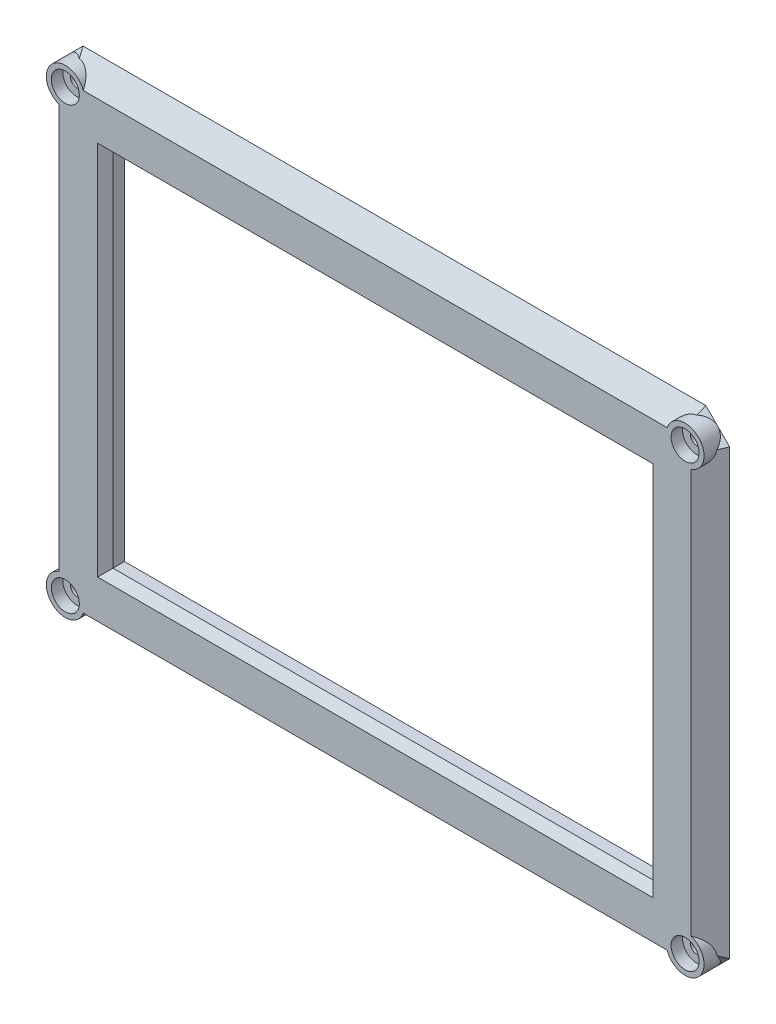
from build123d import *

# Parameters (mm, degrees)
SKETCH1_W                                  = 140.5
SKETCH1_H                                  = 93.8
BOSS_EXTRUDE1_DEPTH                        = 5
CHAMFER1_SIZE                              = 5
CHAMFER2_SIZE                              = 2
SKETCH2_R                                  = 1.65
CUT_EXTRUDE1_DEPTH                         = 15
BOSS_EXTRUDE2_DEPTH                        = 5
CUT_EXTRUDE2_DEPTH                         = 3
MIRROR1_AT_THE_SECOND_PLANE_COPY_1_SKETC_R = 1.65
MIRROR1_AT_THE_SECOND_PLANE_COPY_1_DEPTH   = 15
MIRROR1_AT_THE_SECOND_PLANE_COPY_2_DEPTH   = 5
MIRROR1_AT_THE_SECOND_PLANE_COPY_3_DEPTH   = 3


with BuildPart() as part:
    # Sketch1 → Boss-Extrude1 (new body)
    with BuildSketch(Plane.XY):
        Polygon((-157.987704918, -10.287704918), (4.087704918, -10.287704918), (10.287704918, -4.087704918), (10.287704918, 111.287704918), (4.087704918, 117.487704918), (-157.987704918, 117.487704918), (-164.187704918, 111.287704918), (-164.187704918, -4.087704918), align=None)
        with Locations((-76.95, 53.6)):
            Rectangle(SKETCH1_W, SKETCH1_H, mode=Mode.SUBTRACT)
    extrude(amount=BOSS_EXTRUDE1_DEPTH)

    # Chamfer1
    chamfer1_edges = [part.edges().sort_by_distance(p)[0] for p in [
        (7.187704918, 114.387704918, 5),
        (10.287704918, 53.6, 5),
        (7.187704918, -7.187704918, 5),
        (-76.95, -10.287704918, 5),
        (-161.087704918, -7.187704918, 5),
        (-164.187704918, 53.6, 5),
        (-76.95, 117.487704918, 5),
        (-161.087704918, 114.387704918, 5),
    ]]
    chamfer(chamfer1_edges, length=CHAMFER1_SIZE - 0.0001)  # a hair under: the kernel refuses the full size

    # Chamfer2
    chamfer2_edges = [part.edges().sort_by_distance(p)[0] for p in [
        (-6.7, 53.6, 5),
        (-76.95, 100.5, 5),
        (-147.2, 53.6, 5),
        (-76.95, 6.7, 5),
    ]]
    chamfer(chamfer2_edges, length=CHAMFER2_SIZE)

    # Sketch2 → Cut-Extrude1 (cut)
    with BuildSketch(Plane.XY.offset(5)):
        with Locations((-157.6, -3.7)):
            Circle(SKETCH2_R)
    cut_extrude1 = extrude(amount=-CUT_EXTRUDE1_DEPTH, mode=Mode.SUBTRACT)

    # Sketch2<3> → Boss-Extrude2 (add)
    with BuildSketch(Plane.XY.offset(5)):
        with BuildLine():
            ThreePointArc((-159.187704918, -0.413407069), (-155.659977185, -0.608267237), (-153.95, -3.7))
            ThreePointArc((-153.95, -3.7), (-154.042011509, -4.514381914), (-154.313407069, -5.287704918))
            Line((-154.313407069, -5.287704918), (-152.930164426, -5.287704918))
            ThreePointArc((-152.930164426, -5.287704918), (-152.733713968, -4.504631246), (-152.667640403, -3.7))
            ThreePointArc((-152.667640403, -3.7), (-154.727976358, 0.309944063), (-159.187704918, 0.969835574))
            Line((-159.187704918, 0.969835574), (-159.187704918, -0.413407069))
        make_face()
        with BuildLine():
            ThreePointArc((-154.313407069, -5.287704918), (-160.180939751, -6.280939751), (-159.187704918, -0.413407069))
            Line((-159.187704918, -0.413407069), (-159.187704918, 0.969835574))
            ThreePointArc((-159.187704918, 0.969835574), (-161.087704918, -7.187704918), (-152.930164426, -5.287704918))
            Line((-152.930164426, -5.287704918), (-154.313407069, -5.287704918))
        make_face()
        with BuildLine():
            ThreePointArc((-154.313407069, -5.287704918), (-154.042011509, -4.514381914), (-153.95, -3.7))
            ThreePointArc((-153.95, -3.7), (-155.659977185, -0.608267237), (-159.187704918, -0.413407069))
            Line((-159.187704918, -0.413407069), (-159.187704918, -2.016637106))
            Line((-159.187704918, -2.016637106), (-158.717916434, -2.486425591))
            ThreePointArc((-158.717916434, -2.486425591), (-156.937452687, -2.188864315), (-155.95, -3.7))
            ThreePointArc((-155.95, -3.7), (-156.062974012, -4.300042592), (-156.386425591, -4.817916434))
            Line((-156.386425591, -4.817916434), (-155.916637106, -5.287704918))
            Line((-155.916637106, -5.287704918), (-154.313407069, -5.287704918))
        make_face()
        with BuildLine():
            Line((-159.187704918, -2.016637106), (-159.187704918, -0.413407069))
            ThreePointArc((-159.187704918, -0.413407069), (-160.180939751, -6.280939751), (-154.313407069, -5.287704918))
            Line((-154.313407069, -5.287704918), (-155.916637106, -5.287704918))
            Line((-155.916637106, -5.287704918), (-156.386425591, -4.817916434))
            ThreePointArc((-156.386425591, -4.817916434), (-158.766726189, -4.866726189), (-158.717916434, -2.486425591))
            Line((-158.717916434, -2.486425591), (-159.187704918, -2.016637106))
        make_face()
    boss_extrude2 = extrude(amount=-BOSS_EXTRUDE2_DEPTH)

    # Sketch2<4> → Cut-Extrude2 (cut)
    with BuildSketch(Plane.XY.offset(5)):
        with BuildLine():
            ThreePointArc((-154.313407069, -5.287704918), (-154.042011509, -4.514381914), (-153.95, -3.7))
            ThreePointArc((-153.95, -3.7), (-155.659977185, -0.608267237), (-159.187704918, -0.413407069))
            Line((-159.187704918, -0.413407069), (-159.187704918, -2.016637106))
            Line((-159.187704918, -2.016637106), (-158.717916434, -2.486425591))
            ThreePointArc((-158.717916434, -2.486425591), (-156.937452687, -2.188864315), (-155.95, -3.7))
            ThreePointArc((-155.95, -3.7), (-156.062974012, -4.300042592), (-156.386425591, -4.817916434))
            Line((-156.386425591, -4.817916434), (-155.916637106, -5.287704918))
            Line((-155.916637106, -5.287704918), (-154.313407069, -5.287704918))
        make_face()
        with BuildLine():
            Line((-159.187704918, -2.016637106), (-159.187704918, -0.413407069))
            ThreePointArc((-159.187704918, -0.413407069), (-160.180939751, -6.280939751), (-154.313407069, -5.287704918))
            Line((-154.313407069, -5.287704918), (-155.916637106, -5.287704918))
            Line((-155.916637106, -5.287704918), (-156.386425591, -4.817916434))
            ThreePointArc((-156.386425591, -4.817916434), (-158.766726189, -4.866726189), (-158.717916434, -2.486425591))
            Line((-158.717916434, -2.486425591), (-159.187704918, -2.016637106))
        make_face()
    cut_extrude2 = extrude(amount=-CUT_EXTRUDE2_DEPTH, mode=Mode.SUBTRACT)

    # Mirror1: Cut-Extrude1, Boss-Extrude2, Cut-Extrude2 across plane
    add(cut_extrude1.mirror(Plane(origin=(-76.95, 0, 0), x_dir=(0, 0, 1), z_dir=(1, 0, 0))), mode=Mode.SUBTRACT)
    add(boss_extrude2.mirror(Plane(origin=(-76.95, 0, 0), x_dir=(0, 0, 1), z_dir=(1, 0, 0))))
    add(cut_extrude2.mirror(Plane(origin=(-76.95, 0, 0), x_dir=(0, 0, 1), z_dir=(1, 0, 0))), mode=Mode.SUBTRACT)

    # Mirror1 at the second plane: Cut-Extrude1, Boss-Extrude2, Cut-Extrude2 across plane
    add(cut_extrude1.mirror(Plane(origin=(0, 53.6, 0), x_dir=(0, 0, 1), z_dir=(0, -1, 0))), mode=Mode.SUBTRACT)
    add(boss_extrude2.mirror(Plane(origin=(0, 53.6, 0), x_dir=(0, 0, 1), z_dir=(0, -1, 0))))
    add(cut_extrude2.mirror(Plane(origin=(0, 53.6, 0), x_dir=(0, 0, 1), z_dir=(0, -1, 0))), mode=Mode.SUBTRACT)

    # Mirror1 at the second plane copy 1 sketc → Mirror1 at the second plane copy 1 (cut)
    with BuildSketch(Plane(origin=(-153.9, 107.2, 5), x_dir=(-1, 0, 0), z_dir=(0, 0, 1))):
        with Locations((-157.6, -3.7)):
            Circle(MIRROR1_AT_THE_SECOND_PLANE_COPY_1_SKETC_R)
    extrude(amount=-MIRROR1_AT_THE_SECOND_PLANE_COPY_1_DEPTH, mode=Mode.SUBTRACT)

    # Mirror1 at the second plane copy 2 sketc → Mirror1 at the second plane copy 2 (add)
    with BuildSketch(Plane(origin=(-153.9, 107.2, 5), x_dir=(-1, 0, 0), z_dir=(0, 0, 1))):
        with BuildLine():
            ThreePointArc((-159.187704918, -0.413407069), (-155.659977185, -0.608267237), (-153.95, -3.7))
            ThreePointArc((-153.95, -3.7), (-154.042011509, -4.514381914), (-154.313407069, -5.287704918))
            Line((-154.313407069, -5.287704918), (-152.930164426, -5.287704918))
            ThreePointArc((-152.930164426, -5.287704918), (-152.733713968, -4.504631246), (-152.667640403, -3.7))
            ThreePointArc((-152.667640403, -3.7), (-154.727976358, 0.309944063), (-159.187704918, 0.969835574))
            Line((-159.187704918, 0.969835574), (-159.187704918, -0.413407069))
        make_face()
        with BuildLine():
            ThreePointArc((-154.313407069, -5.287704918), (-160.180939751, -6.280939751), (-159.187704918, -0.413407069))
            Line((-159.187704918, -0.413407069), (-159.187704918, 0.969835574))
            ThreePointArc((-159.187704918, 0.969835574), (-161.087704918, -7.187704918), (-152.930164426, -5.287704918))
            Line((-152.930164426, -5.287704918), (-154.313407069, -5.287704918))
        make_face()
        with BuildLine():
            ThreePointArc((-154.313407069, -5.287704918), (-154.042011509, -4.514381914), (-153.95, -3.7))
            ThreePointArc((-153.95, -3.7), (-155.659977185, -0.608267237), (-159.187704918, -0.413407069))
            Line((-159.187704918, -0.413407069), (-159.187704918, -2.016637106))
            Line((-159.187704918, -2.016637106), (-158.717916434, -2.486425591))
            ThreePointArc((-158.717916434, -2.486425591), (-156.937452687, -2.188864315), (-155.95, -3.7))
            ThreePointArc((-155.95, -3.7), (-156.062974012, -4.300042592), (-156.386425591, -4.817916434))
            Line((-156.386425591, -4.817916434), (-155.916637106, -5.287704918))
            Line((-155.916637106, -5.287704918), (-154.313407069, -5.287704918))
        make_face()
        with BuildLine():
            Line((-159.187704918, -2.016637106), (-159.187704918, -0.413407069))
            ThreePointArc((-159.187704918, -0.413407069), (-160.180939751, -6.280939751), (-154.313407069, -5.287704918))
            Line((-154.313407069, -5.287704918), (-155.916637106, -5.287704918))
            Line((-155.916637106, -5.287704918), (-156.386425591, -4.817916434))
            ThreePointArc((-156.386425591, -4.817916434), (-158.766726189, -4.866726189), (-158.717916434, -2.486425591))
            Line((-158.717916434, -2.486425591), (-159.187704918, -2.016637106))
        make_face()
    extrude(amount=-MIRROR1_AT_THE_SECOND_PLANE_COPY_2_DEPTH)

    # Mirror1 at the second plane copy 3 sketc → Mirror1 at the second plane copy 3 (cut)
    with BuildSketch(Plane(origin=(-153.9, 107.2, 5), x_dir=(-1, 0, 0), z_dir=(0, 0, 1))):
        with BuildLine():
            ThreePointArc((-154.313407069, -5.287704918), (-154.042011509, -4.514381914), (-153.95, -3.7))
            ThreePointArc((-153.95, -3.7), (-155.659977185, -0.608267237), (-159.187704918, -0.413407069))
            Line((-159.187704918, -0.413407069), (-159.187704918, -2.016637106))
            Line((-159.187704918, -2.016637106), (-158.717916434, -2.486425591))
            ThreePointArc((-158.717916434, -2.486425591), (-156.937452687, -2.188864315), (-155.95, -3.7))
            ThreePointArc((-155.95, -3.7), (-156.062974012, -4.300042592), (-156.386425591, -4.817916434))
            Line((-156.386425591, -4.817916434), (-155.916637106, -5.287704918))
            Line((-155.916637106, -5.287704918), (-154.313407069, -5.287704918))
        make_face()
        with BuildLine():
            Line((-159.187704918, -2.016637106), (-159.187704918, -0.413407069))
            ThreePointArc((-159.187704918, -0.413407069), (-160.180939751, -6.280939751), (-154.313407069, -5.287704918))
            Line((-154.313407069, -5.287704918), (-155.916637106, -5.287704918))
            Line((-155.916637106, -5.287704918), (-156.386425591, -4.817916434))
            ThreePointArc((-156.386425591, -4.817916434), (-158.766726189, -4.866726189), (-158.717916434, -2.486425591))
            Line((-158.717916434, -2.486425591), (-159.187704918, -2.016637106))
        make_face()
    extrude(amount=-MIRROR1_AT_THE_SECOND_PLANE_COPY_3_DEPTH, mode=Mode.SUBTRACT)


solid = part.part
